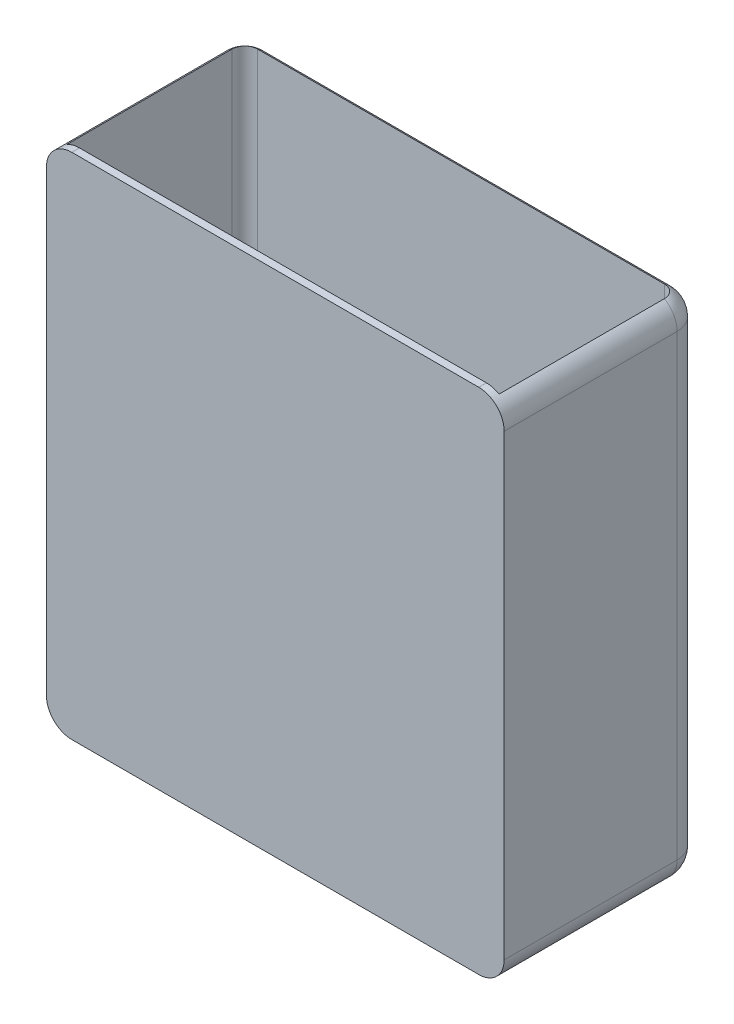
from build123d import *

# Parameters (mm, degrees)
BOSS_EXTRUDE1_DEPTH = 200
CUT_EXTRUDE1_DEPTH  = 193
FILLET1_R           = 10
FILLET2_R           = 10
SKETCH5_W           = 221.977044751
SKETCH5_H           = 222.508090313
CUT_EXTRUDE2_DEPTH  = 2


with BuildPart() as part:
    # Sketch1 → Boss-Extrude1 (new body)
    with BuildSketch(Plane(origin=(0, 0, 0), x_dir=(1, 0, 0), z_dir=(0, 1, 0))):
        with BuildLine():
            Line((-80, 45), (80, 45))
            ThreePointArc((80, 45), (87.071067812, 42.071067812), (90, 35))
            Line((90, 35), (90, -35))
            Line((90, -35), (-90, -35))
            Line((-90, -35), (-90, 35))
            ThreePointArc((-90, 35), (-87.071067812, 42.071067812), (-80, 45))
        make_face()
    extrude(amount=-BOSS_EXTRUDE1_DEPTH)

    # Sketch2 → Cut-Extrude1 (cut)
    with BuildSketch(Plane(origin=(0, 0, 0), x_dir=(1, 0, 0), z_dir=(0, 1, 0))):
        with BuildLine():
            Line((85, -30), (85, 35))
            ThreePointArc((85, 35), (83.535533906, 38.535533906), (80, 40))
            Line((80, 40), (-80, 40))
            ThreePointArc((-80, 40), (-83.535533906, 38.535533906), (-85, 35))
            Line((-85, 35), (-85, -30))
            Line((-85, -30), (85, -30))
        make_face()
    extrude(amount=-CUT_EXTRUDE1_DEPTH, mode=Mode.SUBTRACT)

    # Fillet1
    fillet1_edges = [part.edges().sort_by_distance(p)[0] for p in [
        (0, -200, -45),
        (-87.071067812, -200, -42.071067812),
        (-90, -200, 0),
        (90, -200, 0),
        (87.071067812, -200, -42.071067812),
    ]]
    fillet(fillet1_edges, radius=FILLET1_R)

    # Fillet2
    # the kernel refuses this fillet: 10 mm, written as the material it takes off along each edge
    with BuildSketch(Plane(origin=(90, 0, -35), x_dir=(-1, 0, 0), z_dir=(0, 0, 1)), Plane(origin=(-90, 0, 60), x_dir=(1, 0, 0), z_dir=(0, 0, -1))) as fillet2_piece_1:
        with BuildLine():
            CenterArc((FILLET2_R, FILLET2_R), FILLET2_R, 180, 90)
            Line((0, FILLET2_R), (0, 0))
            Line((0, 0), (FILLET2_R, 0))
        make_face()
    extrude(amount=95, mode=Mode.SUBTRACT)
    with BuildSketch(Plane(origin=(-80, 0, -35), x_dir=(-1, 0, 0), z_dir=(0, 0, 1))) as fillet2_piece_2:
        with BuildLine():
            CenterArc((10 - FILLET2_R, FILLET2_R), FILLET2_R, 270, 90)
            Line((10 - FILLET2_R, 0), (10, 0))
            Line((10, 0), (10, FILLET2_R))
        make_face()
    revolve(axis=Axis((-80, 0, -35), (0, -1, 0)), revolution_arc=90, mode=Mode.SUBTRACT)
    with BuildSketch(Plane(origin=(-80, 0, -45), x_dir=(0, -1, 0), z_dir=(1, 0, 0))) as fillet2_piece_3:
        with BuildLine():
            CenterArc((FILLET2_R, -FILLET2_R), FILLET2_R, 90, 90)
            Line((0, -FILLET2_R), (0, 0))
            Line((0, 0), (FILLET2_R, 0))
        make_face()
    extrude(amount=160, mode=Mode.SUBTRACT)
    with BuildSketch(Plane(origin=(80, 0, -35), x_dir=(0, 0, -1), z_dir=(-1, 0, 0))) as fillet2_piece_4:
        with BuildLine():
            CenterArc((10 - FILLET2_R, FILLET2_R), FILLET2_R, 270, 90)
            Line((10, FILLET2_R), (10, 0))
            Line((10, 0), (10 - FILLET2_R, 0))
        make_face()
    revolve(axis=Axis((80, 0, -35), (0, -1, 0)), revolution_arc=90, mode=Mode.SUBTRACT)

    # Sketch5 → Cut-Extrude2 (cut)
    with BuildSketch(Plane.XY.offset(35)):
        with Locations((11.417479574, -99.417273917)):
            Rectangle(SKETCH5_W, SKETCH5_H)
    extrude(amount=-CUT_EXTRUDE2_DEPTH, mode=Mode.SUBTRACT)


solid = part.part
